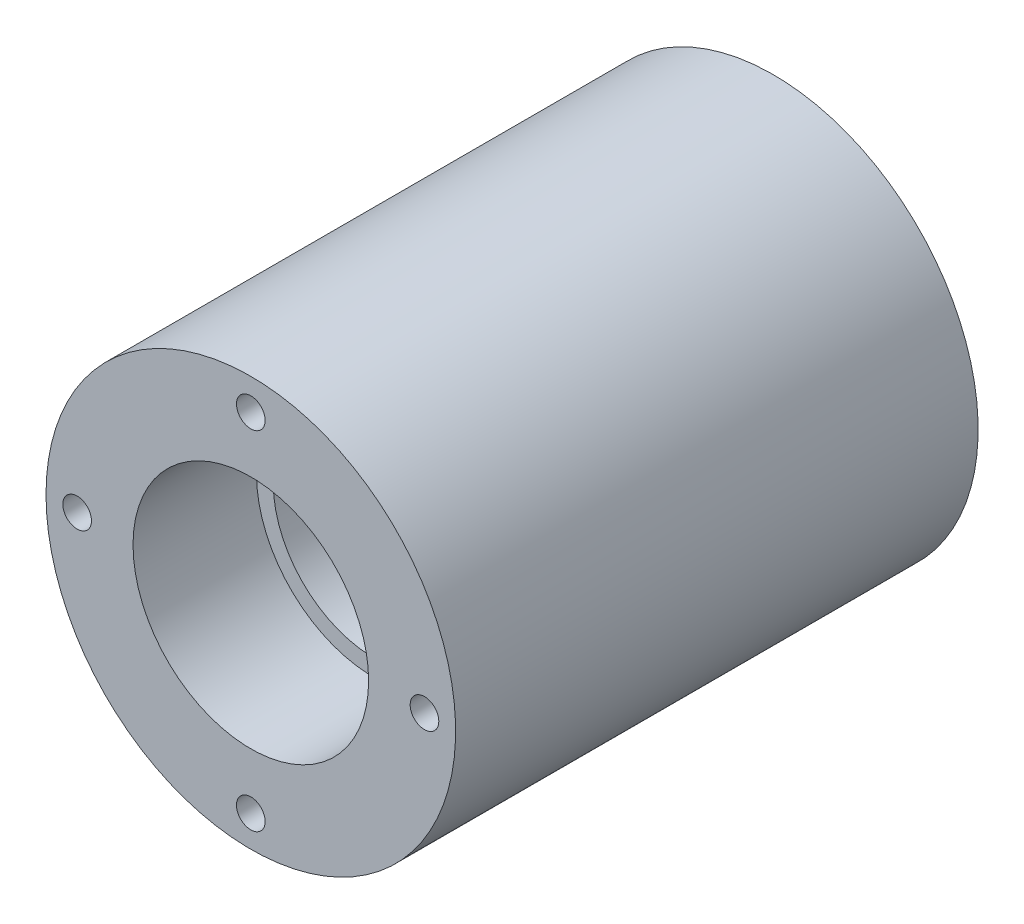
from build123d import *

# Parameters (mm, degrees)
TAP_DRILL_FOR_1_4_20_TAP2_AT_2_COUNT = 2
TAP_DRILL_FOR_1_4_20_TAP2_AT_2_PITCH = 43.780544641
TAP_DRILL_FOR_1_4_20_TAP2_AT_3_COUNT = 2
TAP_DRILL_FOR_1_4_20_TAP2_AT_3_PITCH = 61.91504
TAP_DRILL_FOR_1_4_20_TAP2_AT_4_COUNT = 2
TAP_DRILL_FOR_1_4_20_TAP2_AT_4_PITCH = 43.780544641


with BuildPart() as part:
    # Housing Sketch → Housing Revolve (revolve)
    with BuildSketch(Plane(origin=(0, 0, 0), x_dir=(0, 0, -1), z_dir=(1, 0, 0))):
        Polygon((93.14688, 36.5125), (0, 36.5125), (0, 21), (22, 21), (22, 18), (52.57188, 18), (52.57188, 21), (93.14688, 21), align=None)
    revolve(axis=Axis((0, 0, -141.5522592), (0, 0, 1)))

    # Sketch8 → Tap Drill for 1/4-20 Tap2 (revolve, cut)
    with BuildSketch(Plane(origin=(0, 30.95752, 0), x_dir=(0, -1, 0), z_dir=(1, 0, 0))):
        Polygon((0, 0), (0, 14.233816902), (2.5527, 12.7), (2.5527, 0), align=None)
    tap_drill_for_1_4_20_tap2 = revolve(axis=Axis((0, 30.95752, 6.35), (0, 0, -1)), mode=Mode.SUBTRACT)

    # Tap Drill for 1/4-20 Tap2 at 2: Tap Drill for 1/4-20 Tap2 ×2
    with Locations(*[Vector(0.7071067811865476, -0.7071067811865476, 0) * (i * TAP_DRILL_FOR_1_4_20_TAP2_AT_2_PITCH) for i in range(1, TAP_DRILL_FOR_1_4_20_TAP2_AT_2_COUNT)]):
        add(tap_drill_for_1_4_20_tap2, mode=Mode.SUBTRACT)

    # Tap Drill for 1/4-20 Tap2 at 3: Tap Drill for 1/4-20 Tap2 ×2
    with Locations(*[(0, -i * TAP_DRILL_FOR_1_4_20_TAP2_AT_3_PITCH, 0) for i in range(1, TAP_DRILL_FOR_1_4_20_TAP2_AT_3_COUNT)]):
        add(tap_drill_for_1_4_20_tap2, mode=Mode.SUBTRACT)

    # Tap Drill for 1/4-20 Tap2 at 4: Tap Drill for 1/4-20 Tap2 ×2
    with Locations(*[Vector(-0.7071067811865476, -0.7071067811865476, 0) * (i * TAP_DRILL_FOR_1_4_20_TAP2_AT_4_PITCH) for i in range(1, TAP_DRILL_FOR_1_4_20_TAP2_AT_4_COUNT)]):
        add(tap_drill_for_1_4_20_tap2, mode=Mode.SUBTRACT)

    # Mirror1: Tap Drill for 1/4-20 Tap2 across plane
    add(tap_drill_for_1_4_20_tap2.mirror(Plane(origin=(0, 0, -46.57344), x_dir=(1, 0, 0), z_dir=(0, 0, -1))), mode=Mode.SUBTRACT)

    # Mirror1 copy 1 sketch → Mirror1 copy 1 (revolve, cut)
    with BuildSketch(Plane(origin=(30.95752, 0, -93.14688), x_dir=(0, -1, 0), z_dir=(1, 0, 0))):
        Polygon((0, 0), (0, -14.233816902), (2.5527, -12.7), (2.5527, 0), align=None)
    revolve(axis=Axis((30.95752, 0, -99.49688), (0, 0, -1)), mode=Mode.SUBTRACT)

    # Mirror1 copy 2 sketch → Mirror1 copy 2 (revolve, cut)
    with BuildSketch(Plane(origin=(0, -30.95752, -93.14688), x_dir=(0, -1, 0), z_dir=(1, 0, 0))):
        Polygon((0, 0), (0, -14.233816902), (2.5527, -12.7), (2.5527, 0), align=None)
    revolve(axis=Axis((0, -30.95752, -99.49688), (0, 0, -1)), mode=Mode.SUBTRACT)

    # Mirror1 copy 3 sketch → Mirror1 copy 3 (revolve, cut)
    with BuildSketch(Plane(origin=(-30.95752, 0, -93.14688), x_dir=(0, -1, 0), z_dir=(1, 0, 0))):
        Polygon((0, 0), (0, -14.233816902), (2.5527, -12.7), (2.5527, 0), align=None)
    revolve(axis=Axis((-30.95752, 0, -99.49688), (0, 0, -1)), mode=Mode.SUBTRACT)


solid = part.part
